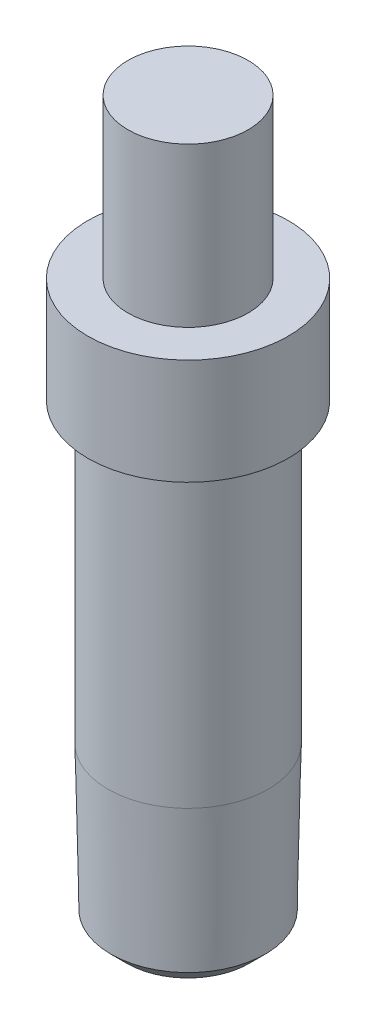
from build123d import *

# Parameters (mm, degrees)
SKETCH2_R           = 1.25
BOSS_EXTRUDE1_DEPTH = 9


with BuildPart() as part:
    # Sketch2 → Boss-Extrude1 (new body)
    with BuildSketch(Plane(origin=(0, 0, 0), x_dir=(1, 0, 0), z_dir=(0, 1, 0))):
        Circle(SKETCH2_R)
    extrude(amount=BOSS_EXTRUDE1_DEPTH)

    # Sketch4 → Cut-Revolve1 (revolve, cut)
    with BuildSketch(Plane.XY):
        Polygon((0.75, 9), (0.75, 7.02), (1.25, 7.02), (1.25, 5.7), (1, 5.7), (1, 2), (0.963866832, 0.2), (0.763866832, 0), (1.75, 0), (1.75, 9), align=None)
    revolve(axis=Axis((0, 9, 0), (0, -1, 0)), mode=Mode.SUBTRACT)


solid = part.part
